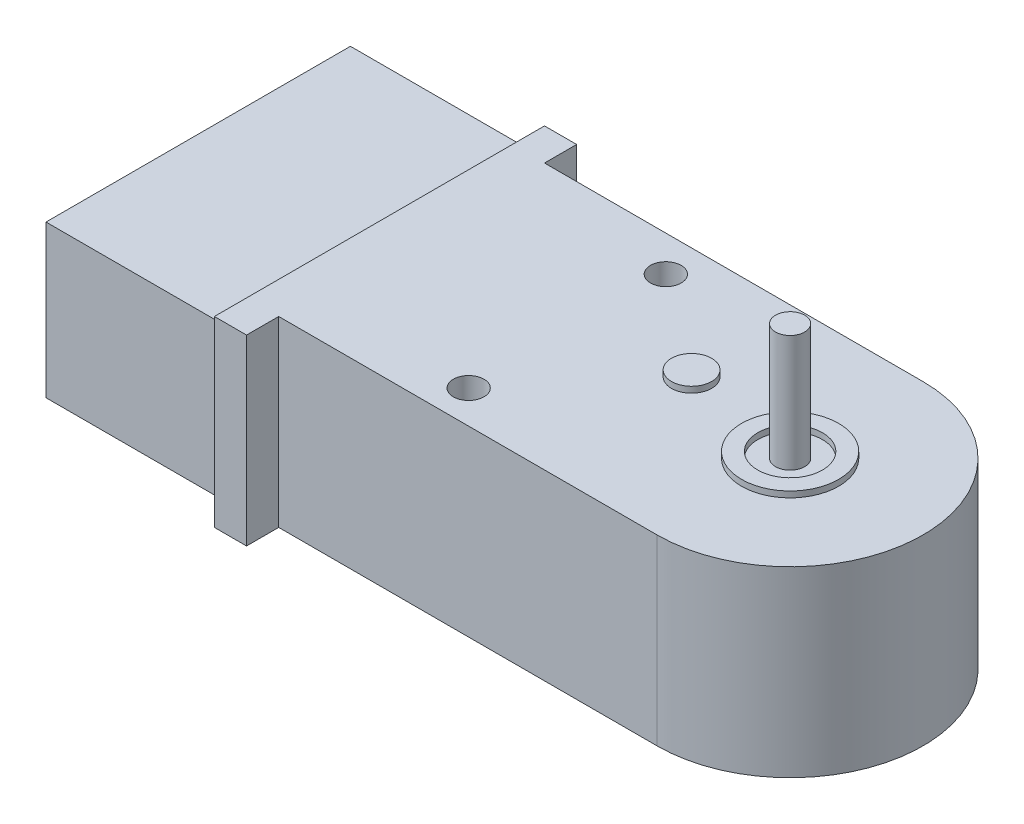
from build123d import *

# Parameters (mm, degrees)
GEAR_BOX_DEPTH      = 6.86
GEAR_BOX_DEPTH_BACK = 6.86
MOTOR_DEPTH         = 5.715
MOTOR_DEPTH_BACK    = 5.715
SKETCH2_W           = 13.61
SKETCH2_H           = 22.86
SKETCH3_R           = 1.51
SKETCH3_R_2         = 3.645
SKETCH3_R_3         = 2.43
SPACER_DEPTH        = 0.45
SPACER_BACK_START   = 0.45
SKETCH5_R           = 3.645
SKETCH5_R_2         = 2.43
SPACER_BACK_DEPTH   = 0.45
SKETCH4_R           = 1.095
OUTPUT_SHAFT_DEPTH  = 8.76
SKETCH7_R           = 1.15
CUT_EXTRUDE1_DEPTH  = 5


with BuildPart() as part:
    # Sketch1 → Gear Box (new, two sides: drawn at the far end of the back side and taken through both)
    with BuildSketch(Plane(origin=(0, 0, 0), x_dir=(1, 0, 0), z_dir=(0, 1, 0)).offset(-GEAR_BOX_DEPTH_BACK)):
        with BuildLine():
            Line((0, 9.98), (-28.425, 9.98))
            Line((-28.425, 9.98), (-28.425, 12.395))
            Line((-28.425, 12.395), (-30.84, 12.395))
            Line((-30.84, 12.395), (-30.84, -12.395))
            Line((-30.84, -12.395), (-28.425, -12.395))
            Line((-28.425, -12.395), (-28.425, -9.98))
            Line((-28.425, -9.98), (0, -9.98))
            ThreePointArc((0, -9.98), (9.98, 0), (0, 9.98))
        make_face()
    extrude(amount=GEAR_BOX_DEPTH + GEAR_BOX_DEPTH_BACK)

    # Sketch2 → Motor (add, two sides: drawn at the far end of the back side and taken through both)
    with BuildSketch(Plane(origin=(0, 0, 0), x_dir=(1, 0, 0), z_dir=(0, 1, 0)).offset(-MOTOR_DEPTH_BACK)):
        with Locations((-37.645, 0)):
            Rectangle(SKETCH2_W, SKETCH2_H)
    extrude(amount=MOTOR_DEPTH + MOTOR_DEPTH_BACK)

    # Sketch3 → Spacer (add)
    # profile 1 of 2: a face of its own
    with BuildSketch(Plane(origin=(0, 6.86, 0), x_dir=(1, 0, 0), z_dir=(0, 1, 0))):
        with Locations((-9, 1.6)):
            Circle(SKETCH3_R)
    # profile 2 of 2: a face of its own
    with BuildSketch(Plane(origin=(0, 6.86, 0), x_dir=(1, 0, 0), z_dir=(0, 1, 0))):
        Circle(SKETCH3_R_2)
        Circle(SKETCH3_R_3, mode=Mode.SUBTRACT)
    extrude(amount=SPACER_DEPTH)

    # Sketch5 → Spacer(back) (add)
    with BuildSketch(Plane.XZ.offset(6.86).offset(SPACER_BACK_START)):
        Circle(SKETCH5_R)
        Circle(SKETCH5_R_2, mode=Mode.SUBTRACT)
    extrude(amount=-SPACER_BACK_DEPTH)

    # Sketch4 → Output Shaft (add)
    with BuildSketch(Plane(origin=(0, 6.86, 0), x_dir=(1, 0, 0), z_dir=(0, 1, 0))):
        Circle(SKETCH4_R)
    extrude(amount=OUTPUT_SHAFT_DEPTH)

    # Sketch7 → Cut-Extrude1 (cut)
    with BuildSketch(Plane(origin=(0, 6.86, 0), x_dir=(1, 0, 0), z_dir=(0, 1, 0))):
        with Locations((-16.64, 7.30523239)):
            Circle(SKETCH7_R)
        with Locations((-16.64, -7.5)):
            Circle(SKETCH7_R)
    extrude(amount=-CUT_EXTRUDE1_DEPTH, mode=Mode.SUBTRACT)


solid = part.part
